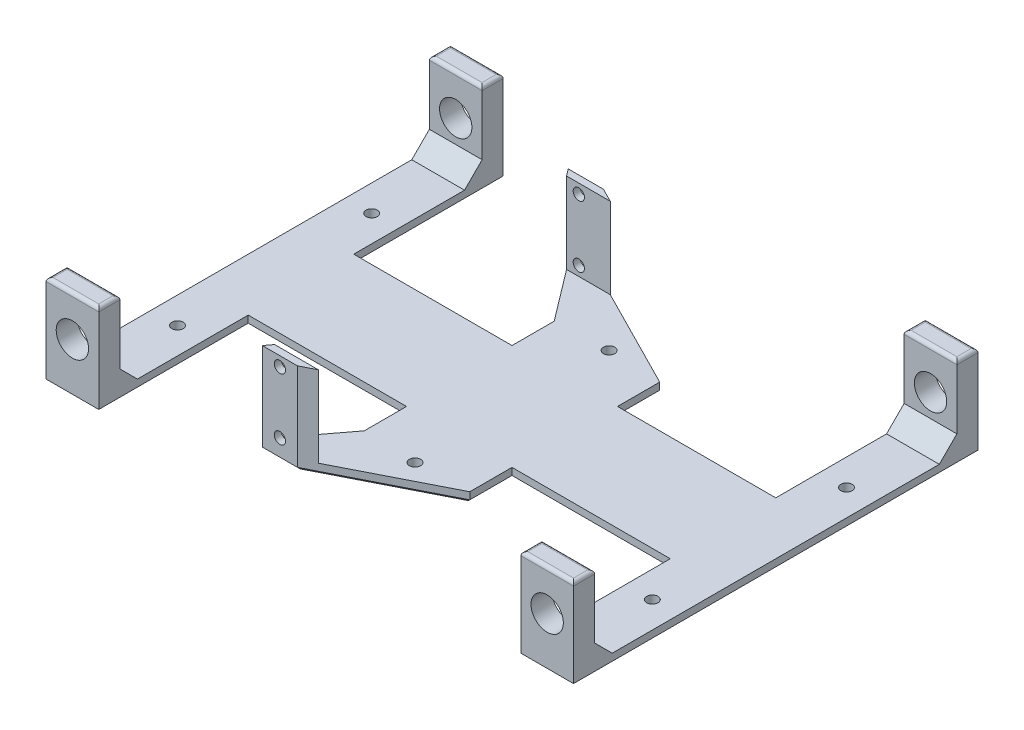
from build123d import *

# Parameters (mm, degrees)
BOSS_EXTRUDE1_DEPTH = 3
SKETCH3_W           = 15
SKETCH3_H           = 6
BOSS_EXTRUDE2_DEPTH = 23
SKETCH4_R           = 1.6
CUT_EXTRUDE1_DEPTH  = 23
SKETCH5_R           = 4.6
CUT_EXTRUDE2_DEPTH  = 23
SKETCH6_R           = 1.6
CUT_EXTRUDE3_DEPTH  = 23
CHAMFER1_SIZE       = 1
FILLET1_R           = 1
CHAMFER2_SIZE       = 5


with BuildPart() as part:
    # Sketch2 → Boss-Extrude1 (new body)
    with BuildSketch(Plane(origin=(0, 0, 0), x_dir=(1, 0, 0), z_dir=(0, 1, 0))):
        Polygon((-60, 57.5), (-75, 57.5), (-75, -57.5), (-60, -57.5), (-60, -15), (-15, -15), (-15, -27), (-27.5, -43.5), (-17.5, -43.5), (15, -27), (15, -15), (60, -15), (60, -57.5), (75, -57.5), (75, 57.5), (60, 57.5), (60, 15), (15, 15), (15, 27), (-17.5, 43.5), (-27.5, 43.5), (-15, 27), (-15, 15), (-60, 15), align=None)
    extrude(amount=BOSS_EXTRUDE1_DEPTH)

    # Sketch3 → Boss-Extrude2 (add)
    with BuildSketch(Plane(origin=(0, 3, 0), x_dir=(1, 0, 0), z_dir=(0, 1, 0))):
        with Locations((-67.5, 54.5)):
            Rectangle(SKETCH3_W, SKETCH3_H)
        Polygon((-17.5, 43.5), (-27.5, 43.5), (-25.984848485, 41.5), (-13.560606061, 41.5), align=None)
        with Locations((67.5, 54.5)):
            Rectangle(SKETCH3_W, SKETCH3_H)
    extrude(amount=BOSS_EXTRUDE2_DEPTH)

    # Sketch4 → Cut-Extrude1 (cut)
    with BuildSketch(Plane(origin=(0, 0, -43.5), x_dir=(-1, 0, 0), z_dir=(0, 0, -1))):
        with Locations((22.5, 23.25)):
            Circle(SKETCH4_R)
        with Locations((22.5, 5.75)):
            Circle(SKETCH4_R)
    extrude(amount=-CUT_EXTRUDE1_DEPTH, mode=Mode.SUBTRACT)

    # Sketch5 → Cut-Extrude2 (cut)
    with BuildSketch(Plane(origin=(0, 0, -57.5), x_dir=(-1, 0, 0), z_dir=(0, 0, -1))):
        with Locations((67.5, 14.5)):
            Circle(SKETCH5_R)
    cut_extrude2 = extrude(amount=-CUT_EXTRUDE2_DEPTH, mode=Mode.SUBTRACT)

    # Mirror3: Cut-Extrude2 across plane
    add(cut_extrude2.mirror(Plane(origin=(0, 0, 0), x_dir=(0, 0, 1), z_dir=(1, 0, 0))), mode=Mode.SUBTRACT)

    # Mirror4: part across plane


with BuildPart() as part_1:
    add(part.part)
    add(part.part.mirror(Plane.XY))

    # Sketch6 → Cut-Extrude3 (cut)
    with BuildSketch(Plane(origin=(0, 3, 0), x_dir=(1, 0, 0), z_dir=(0, 1, 0))):
        with Locations((-67.5, 27.6)):
            Circle(SKETCH6_R)
        with Locations((0, 27.6)):
            Circle(SKETCH6_R)
        with Locations((67.5, 27.6)):
            Circle(SKETCH6_R)
        with Locations((67.5, -27.6)):
            Circle(SKETCH6_R)
        with Locations((0, -27.6)):
            Circle(SKETCH6_R)
        with Locations((-67.5, -27.6)):
            Circle(SKETCH6_R)
    extrude(amount=-CUT_EXTRUDE3_DEPTH, mode=Mode.SUBTRACT)

    # Chamfer1
    chamfer1_edges = [part_1.edges().sort_by_distance(p)[0] for p in [
        (-67.5, 0, 57.5),
        (-37.5, 0, 15),
        (-15, 0, 21),
        (-21.25, 0, 35.25),
        (-22.5, 0, 43.5),
        (-1.25, 0, 35.25),
        (15, 0, 21),
        (37.5, 0, 15),
        (60, 0, 36.25),
        (67.5, 0, 57.5),
        (75, 0, 0),
        (67.5, 0, -57.5),
        (60, 0, -36.25),
        (37.5, 0, -15),
        (15, 0, -21),
        (-1.25, 0, -35.25),
        (-22.5, 0, -43.5),
        (-21.25, 0, -35.25),
        (-15, 0, -21),
        (-37.5, 0, -15),
        (-60, 0, -36.25),
        (-67.5, 0, -57.5),
        (-75, 0, 0),
        (-60, 0, 36.25),
    ]]
    chamfer(chamfer1_edges, length=CHAMFER1_SIZE)

    # Fillet1
    fillet1_edges = [part_1.edges().sort_by_distance(p)[0] for p in [
        (75, 26, 54.5),
        (67.5, 26, 57.5),
        (60, 26, 54.5),
        (67.5, 26, 51.5),
        (60, 26, -54.5),
        (67.5, 26, -57.5),
        (75, 26, -54.5),
        (67.5, 26, -51.5),
        (-67.5, 26, -57.5),
        (-60, 26, -54.5),
        (-67.5, 26, -51.5),
        (-75, 26, -54.5),
        (-75, 26, 54.5),
        (-67.5, 26, 51.5),
        (-60, 26, 54.5),
        (-67.5, 26, 57.5),
    ]]
    fillet(fillet1_edges, radius=FILLET1_R)

    # Chamfer2
    chamfer2_edges = [part_1.edges().sort_by_distance(p)[0] for p in [
        (-67.5, 3, 51.5),
        (67.5, 3, 51.5),
        (67.5, 3, -51.5),
        (-67.5, 3, -51.5),
    ]]
    chamfer(chamfer2_edges, length=CHAMFER2_SIZE)


solid = part_1.part
